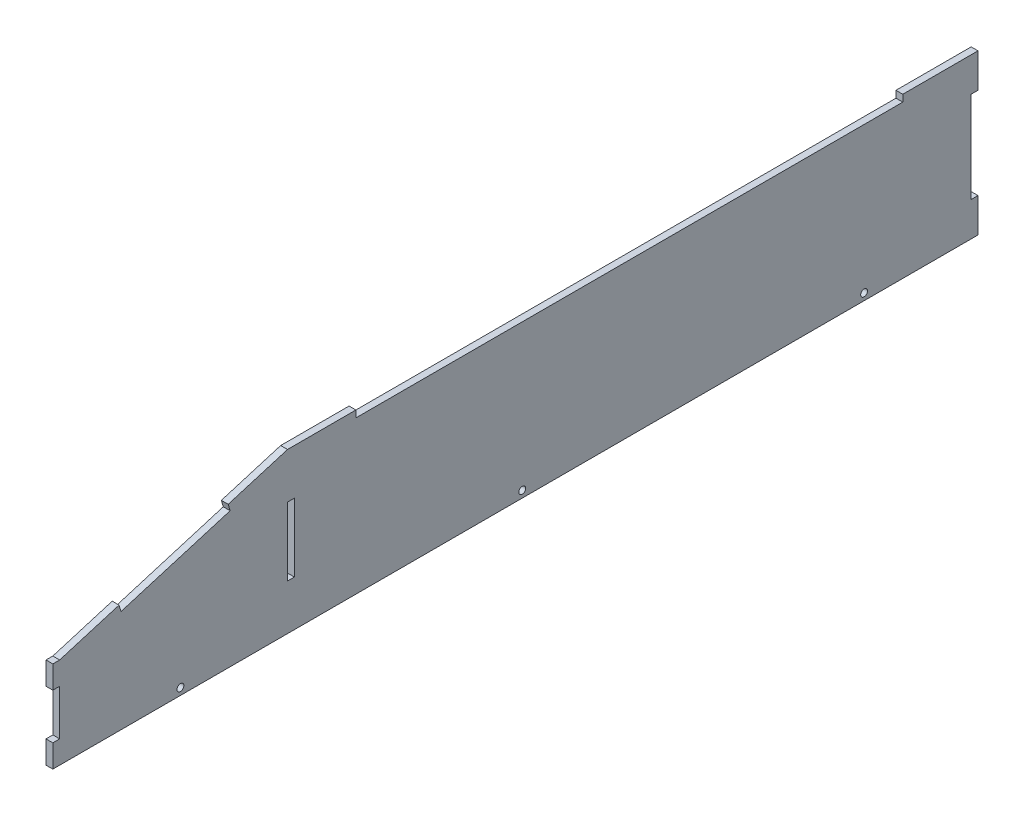
from build123d import *

# Parameters (mm, degrees)
BOSS_EXTRUDE1_DEPTH      = 3
CUT_EXTRUDE2_DEPTH       = 295.638673234
CUT_EXTRUDE2_DEPTH_BACK  = 3
CUT_EXTRUDE6_DEPTH       = 295.638673234
CUT_EXTRUDE6_DEPTH_BACK  = 3
CUT_EXTRUDE11_DEPTH      = 295.638673234
CUT_EXTRUDE11_DEPTH_BACK = 3
CUT_EXTRUDE12_DEPTH      = 295.638673234
CUT_EXTRUDE12_DEPTH_BACK = 3
SKETCH9_W                = 3
SKETCH9_H                = 30
CUT_EXTRUDE13_DEPTH      = 3
SKETCH10_R               = 1.5
CUT_EXTRUDE14_DEPTH      = 10


with BuildPart() as part:
    # Sketch1 → Boss-Extrude1 (new body)
    with BuildSketch(Plane(origin=(0, 0, 0), x_dir=(0, 0, -1), z_dir=(1, 0, 0))):
        Polygon((286.144320394, 0.17389594), (286.144320394, 70.17389594), (-16.855679606, 70.17389594), (-116.855679606, 40.17389594), (-119.855679606, 40.17389594), (-119.855679606, 0.17389594), align=None)
    extrude(amount=BOSS_EXTRUDE1_DEPTH)

    # Sketch5 → Cut-Extrude2 (cut, two sides: drawn at the far end of the back side and taken through both)
    with BuildSketch(Plane(origin=(3, 0, 0), x_dir=(0, 0, -1), z_dir=(1, 0, 0)).offset(-CUT_EXTRUDE2_DEPTH_BACK)):
        Polygon((1115.56118622, 55.17389594), (286.144320394, 55.17389594), (283.144320394, 55.17389594), (283.144320394, 15.17389594), (286.144320394, 15.17389594), (1115.56118622, 15.17389594), (2774.394917872, 15.17389594), (2774.394917872, 55.17389594), align=None)
    extrude(amount=CUT_EXTRUDE2_DEPTH + CUT_EXTRUDE2_DEPTH_BACK, mode=Mode.SUBTRACT)

    # Sketch6 → Cut-Extrude6 (cut, two sides: drawn at the far end of the back side and taken through both)
    with BuildSketch(Plane(origin=(3, 0, 0), x_dir=(0, 0, -1), z_dir=(1, 0, 0)).offset(-CUT_EXTRUDE6_DEPTH_BACK)):
        Polygon((253.144320394, 839.196952243), (253.144320394, 70.17389594), (253.144320394, 67.17389594), (13.144320394, 67.17389594), (13.144320394, 70.17389594), (13.144320394, 839.196952243), (13.144320394, 2377.24306485), (253.144320394, 2377.24306485), align=None)
    extrude(amount=CUT_EXTRUDE6_DEPTH + CUT_EXTRUDE6_DEPTH_BACK, mode=Mode.SUBTRACT)

    # Sketch7 → Cut-Extrude11 (cut, two sides: drawn at the far end of the back side and taken through both)
    with BuildSketch(Plane(origin=(3, 0, 0), x_dir=(0, 0, -1), z_dir=(1, 0, 0)).offset(-CUT_EXTRUDE11_DEPTH_BACK)):
        Polygon((-264.146282978, 799.817128167), (-42.908554564, 62.358033452), (-42.046510907, 59.484554597), (-89.937825168, 45.117160318), (-90.799868825, 47.990639174), (-312.037597239, 785.449733889), (-754.513054068, 2260.367923318), (-706.621739807, 2274.735317597), align=None)
    extrude(amount=CUT_EXTRUDE11_DEPTH + CUT_EXTRUDE11_DEPTH_BACK, mode=Mode.SUBTRACT)

    # Sketch8 → Cut-Extrude12 (cut, two sides: drawn at the far end of the back side and taken through both)
    with BuildSketch(Plane(origin=(3, 0, 0), x_dir=(0, 0, -1), z_dir=(1, 0, 0)).offset(-CUT_EXTRUDE12_DEPTH_BACK)):
        Polygon((-950.674782697, 30.17389594), (-119.855679606, 30.17389594), (-116.855679606, 30.17389594), (-116.855679606, 10.17389594), (-119.855679606, 10.17389594), (-950.674782697, 10.17389594), (-2612.31298888, 10.17389594), (-2612.31298888, 30.17389594), align=None)
    extrude(amount=CUT_EXTRUDE12_DEPTH + CUT_EXTRUDE12_DEPTH_BACK, mode=Mode.SUBTRACT)

    # Sketch9 → Cut-Extrude13 (cut)
    with BuildSketch(Plane(origin=(3, 0, 0), x_dir=(0, 0, -1), z_dir=(1, 0, 0))):
        with Locations((-15.355679606, 35.17389594)):
            Rectangle(SKETCH9_W, SKETCH9_H)
    extrude(amount=-CUT_EXTRUDE13_DEPTH, mode=Mode.SUBTRACT)

    # Sketch10 → Cut-Extrude14 (cut)
    with BuildSketch(Plane(origin=(3, 0, 0), x_dir=(0, 0, -1), z_dir=(1, 0, 0))):
        with Locations((236.144320394, 3.17389594)):
            Circle(SKETCH10_R)
        with Locations((86.144320394, 3.17389594)):
            Circle(SKETCH10_R)
        with Locations((-63.855679606, 3.17389594)):
            Circle(SKETCH10_R)
    extrude(amount=-CUT_EXTRUDE14_DEPTH, mode=Mode.SUBTRACT)


solid = part.part
